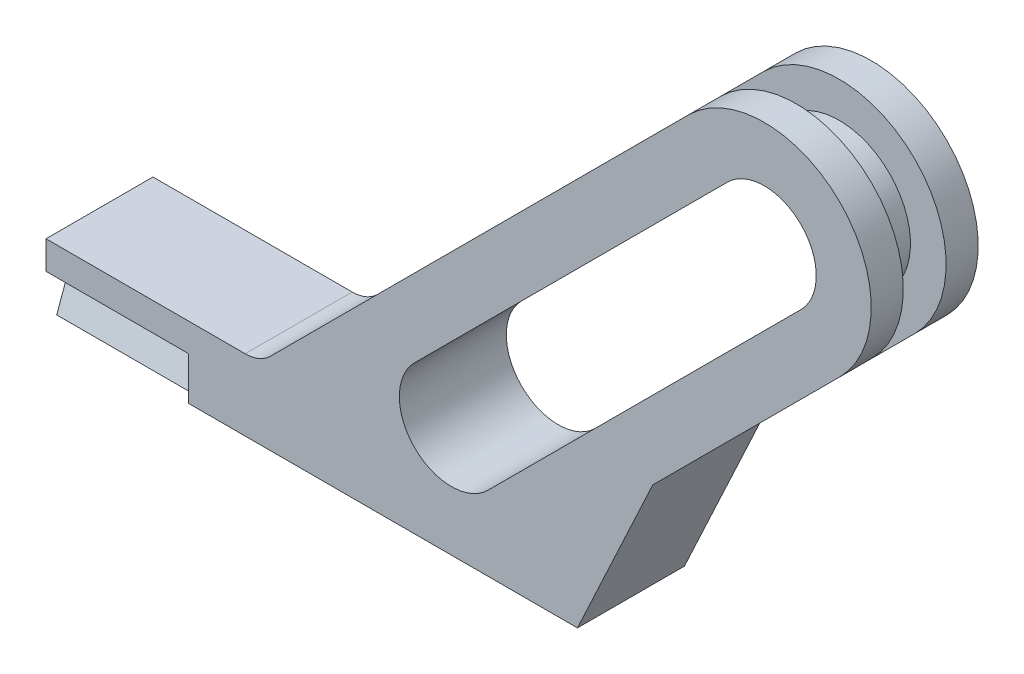
from build123d import *

# Parameters (mm, degrees)
BOSS_EXTRUDE1_DEPTH = 15
FILLET1_R           = 5
SKETCH4_W           = 6
SKETCH4_H           = 10
FILLET3_START       = 4.5
FILLET3_DEPTH       = 6
CUT_EXTRUDE1_REACH  = 110.311
CUT_EXTRUDE2_DEPTH  = 20
FILLET4_R           = 0.2


with BuildPart() as part:
    # Sketch1 → Boss-Extrude1 (new body)
    with BuildSketch(Plane.XY):
        with BuildLine():
            Line((0, 0), (60.104076401, 60.104076401))
            ThreePointArc((60.104076401, 60.104076401), (81.317279836, 60.104076401), (81.317279836, 38.890872965))
            Line((81.317279836, 38.890872965), (55.084101547, 12.657694676))
            Line((55.084101547, 12.657694676), (44.518645004, -10))
            Line((44.518645004, -10), (-30, -10))
            Line((-30, -10), (-30, 0))
            Line((-30, 0), (0, 0))
        make_face()
    extrude(amount=BOSS_EXTRUDE1_DEPTH)

    # Fillet1
    fillet1_edges = [part.edges().sort_by_distance(p)[0] for p in [
        (0, 0, 7.5),
    ]]
    fillet(fillet1_edges, radius=FILLET1_R)

    # Cut-Sweep1: sweep along a path in Sketch3
    with BuildLine(Plane.XY.offset(7.5)) as cut_sweep1_path:
        ThreePointArc((81.317279836, 38.890872965), (81.317279836, 60.104076401), (60.104076401, 60.104076401))
    # Sketch4 → Cut-Sweep1 (sweep, cut)
    with BuildSketch(Plane(origin=(60.104076401, 60.104076401, 0), x_dir=(0, 0, -1), z_dir=(-0.7071067811865462, -0.7071067811865489, 0))):
        with Locations((-7.5, 0)):
            Rectangle(SKETCH4_W, SKETCH4_H)
    sweep(path=cut_sweep1_path.line, mode=Mode.SUBTRACT)

    # Fillet3: read off the stored shape, not the designer's step
    # Fillet3 outline → Fillet3 (cut)
    with BuildSketch(Plane.XY.offset(FILLET3_START)):
        with BuildLine():
            add(Edge.make_bspline(
                [(75.193555479, 32.767148608), (79.276038384, 36.849631513), (77.781745931, 42.426406871)],
                knots=[0, 0, 0, 1, 1, 1], degree=2, weights=[1, 0.111111111, 1]))
            Line((75.193555479, 32.767148608), (81.317279836, 38.890872965))
            Line((81.317279836, 38.890872965), (77.781745931, 42.426406871))
        make_face()
        with BuildLine():
            Line((60.104076401, 60.104076401), (53.980352044, 53.980352044))
            add(Edge.make_bspline(
                [(53.980352044, 53.980352044), (58.062834949, 58.062834949), (63.639610307, 56.568542495)],
                knots=[0, 0, 0, 1, 1, 1], degree=2, weights=[1, 0.111111111, 1]))
            Line((63.639610307, 56.568542495), (60.104076401, 60.104076401))
        make_face()
    extrude(amount=FILLET3_DEPTH, mode=Mode.SUBTRACT)

    # Sketch5 → Cut-Extrude1 (cut, up to next)
    with BuildSketch(Plane(origin=(0, 0, 0), x_dir=(-1, 0, 0), z_dir=(0, 0, -1)), mode=Mode.PRIVATE) as cut_extrude1_sk1:
        with BuildLine():
            Line((-65.553913935, 54.654238867), (-21.67846541, 10.778790341))
            ThreePointArc((-21.67846541, 10.778790341), (-21.67846541, 0.465261974), (-31.991993777, 0.465261974))
            Line((-31.991993777, 0.465261974), (-75.867442302, 44.3407105))
            ThreePointArc((-75.867442302, 44.3407105), (-75.867442302, 54.654238867), (-65.553913935, 54.654238867))
        make_face()
    cut_extrude1_tool1 = extrude(cut_extrude1_sk1.sketch, amount=-CUT_EXTRUDE1_REACH, mode=Mode.PRIVATE) & part.part
    add(cut_extrude1_tool1.solids().sort_by_distance((48.772954, 27.55975, 0))[0], mode=Mode.SUBTRACT)

    # Sketch7 → Cut-Extrude2 (cut)
    with BuildSketch(Plane.ZY.offset(30)):
        Polygon((15, -3.955549677), (11.3, -3.955549677), (13.5, -10), (15, -10), align=None)
        Polygon((0, -10), (0, -3.955549677), (3.7, -3.955549677), (1.5, -10), align=None)
    extrude(amount=-CUT_EXTRUDE2_DEPTH, mode=Mode.SUBTRACT)

    # Fillet4
    fillet4_edges = [part.edges().sort_by_distance(p)[0] for p in [
        (-10, -3.955549677, 13.15),
        (-20, -3.955549677, 11.3),
        (-10, -3.955549677, 1.85),
        (-20, -3.955549677, 3.7),
    ]]
    fillet(fillet4_edges, radius=FILLET4_R)


solid = part.part
